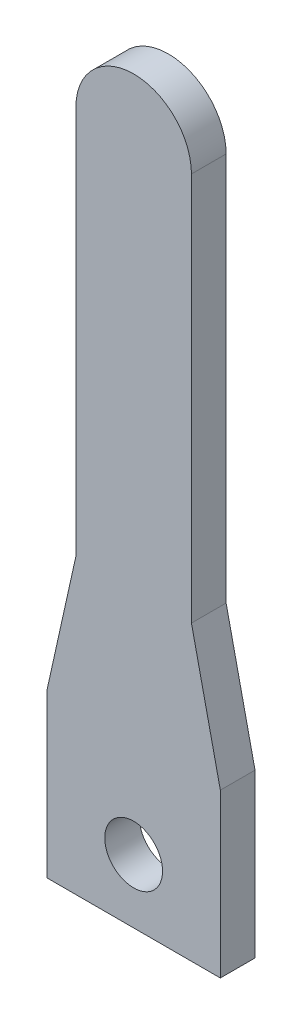
from build123d import *

# Parameters (mm, degrees)
SKETCH1_R           = 2.5
BOSS_EXTRUDE1_DEPTH = 3


with BuildPart() as part:
    # Sketch1 → Boss-Extrude1 (new body)
    with BuildSketch(Plane.XY):
        with BuildLine():
            Line((-7.5, -32), (7.5, -32))
            Line((7.5, -32), (7.5, -17.922075543))
            Line((7.5, -17.922075543), (5, -6.655408876))
            Line((5, -6.655408876), (5, 27))
            ThreePointArc((5, 27), (0, 32), (-5, 27))
            Line((-5, 27), (-5, -6.655408876))
            Line((-5, -6.655408876), (-7.5, -17.922075543))
            Line((-7.5, -17.922075543), (-7.5, -32))
        make_face()
        with Locations((0, -26.5)):
            Circle(SKETCH1_R, mode=Mode.SUBTRACT)
    extrude(amount=BOSS_EXTRUDE1_DEPTH)


solid = part.part
